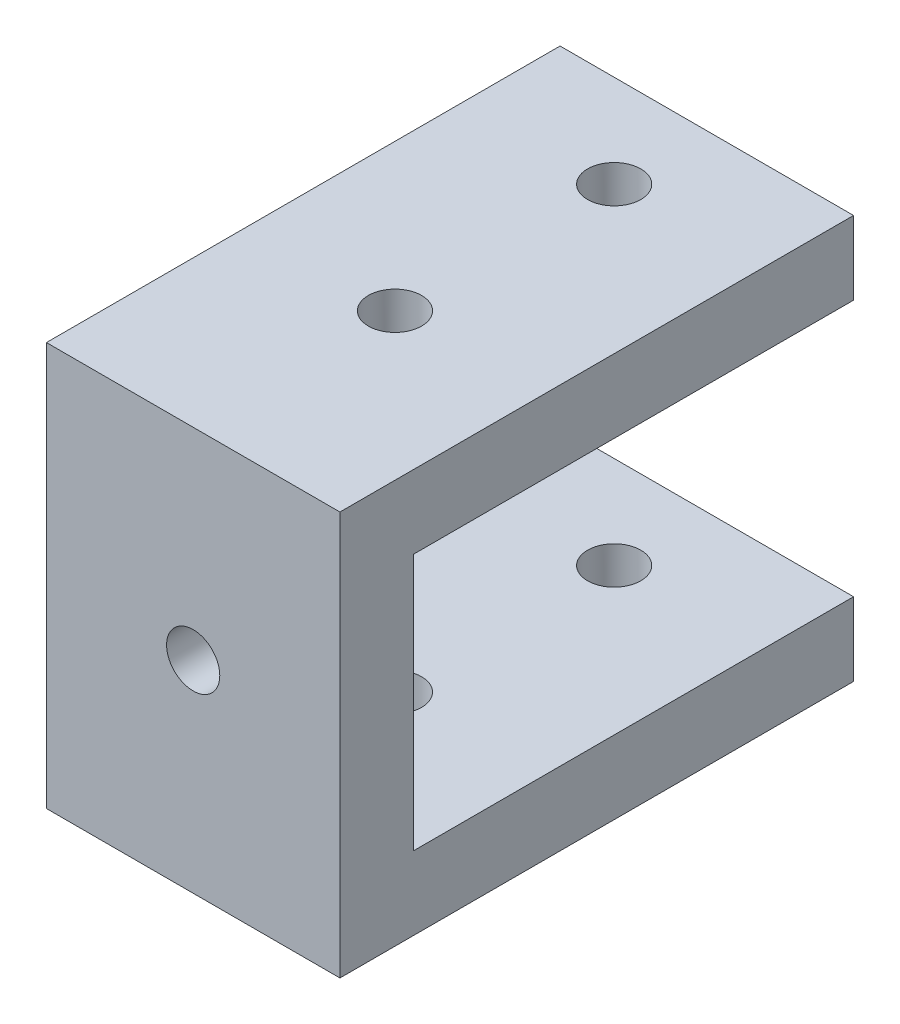
from build123d import *

# Parameters (mm, degrees)
BOSS_EXTRUDE1_DEPTH     = 20.32
CUT_EXTRUDE1_REACH      = 45.273
SKETCH2_R               = 1.8415
CUT_EXTRUDE2_DEPTH      = 47.071427154
CUT_EXTRUDE2_DEPTH_BACK = 47.071427154
SKETCH3_R               = 1.8415


with BuildPart() as part:
    # Sketch1 → Boss-Extrude1 (new body)
    with BuildSketch(Plane(origin=(0, 0, 0), x_dir=(0, 0, -1), z_dir=(1, 0, 0))):
        Polygon((0, 8.89), (0, -8.89), (30.48, -8.89), (30.48, -13.97), (-5.08, -13.97), (-5.08, 13.97), (30.48, 13.97), (30.48, 8.89), align=None)
    extrude(amount=BOSS_EXTRUDE1_DEPTH)

    # Sketch2 → Cut-Extrude1 (cut, up to next)
    with BuildSketch(Plane.XY.offset(5.08), mode=Mode.PRIVATE) as cut_extrude1_sk1:
        with Locations((10.16, 0)):
            Circle(SKETCH2_R)
    cut_extrude1_tool1 = extrude(cut_extrude1_sk1.sketch, amount=-CUT_EXTRUDE1_REACH, mode=Mode.PRIVATE) & part.part
    add(cut_extrude1_tool1.solids().sort_by_distance((10.16, 0, 5.08))[0], mode=Mode.SUBTRACT)

    # Sketch3 → Cut-Extrude2 (cut, two sides: drawn at the far end of the back side and taken through both)
    with BuildSketch(Plane(origin=(0, 13.97, 0), x_dir=(1, 0, 0), z_dir=(0, 1, 0)).offset(-CUT_EXTRUDE2_DEPTH_BACK)):
        with Locations((10.16, 8.89)):
            Circle(SKETCH3_R)
        with Locations((10.16, 24.0665)):
            Circle(SKETCH3_R)
    extrude(amount=CUT_EXTRUDE2_DEPTH + CUT_EXTRUDE2_DEPTH_BACK, mode=Mode.SUBTRACT)


solid = part.part
